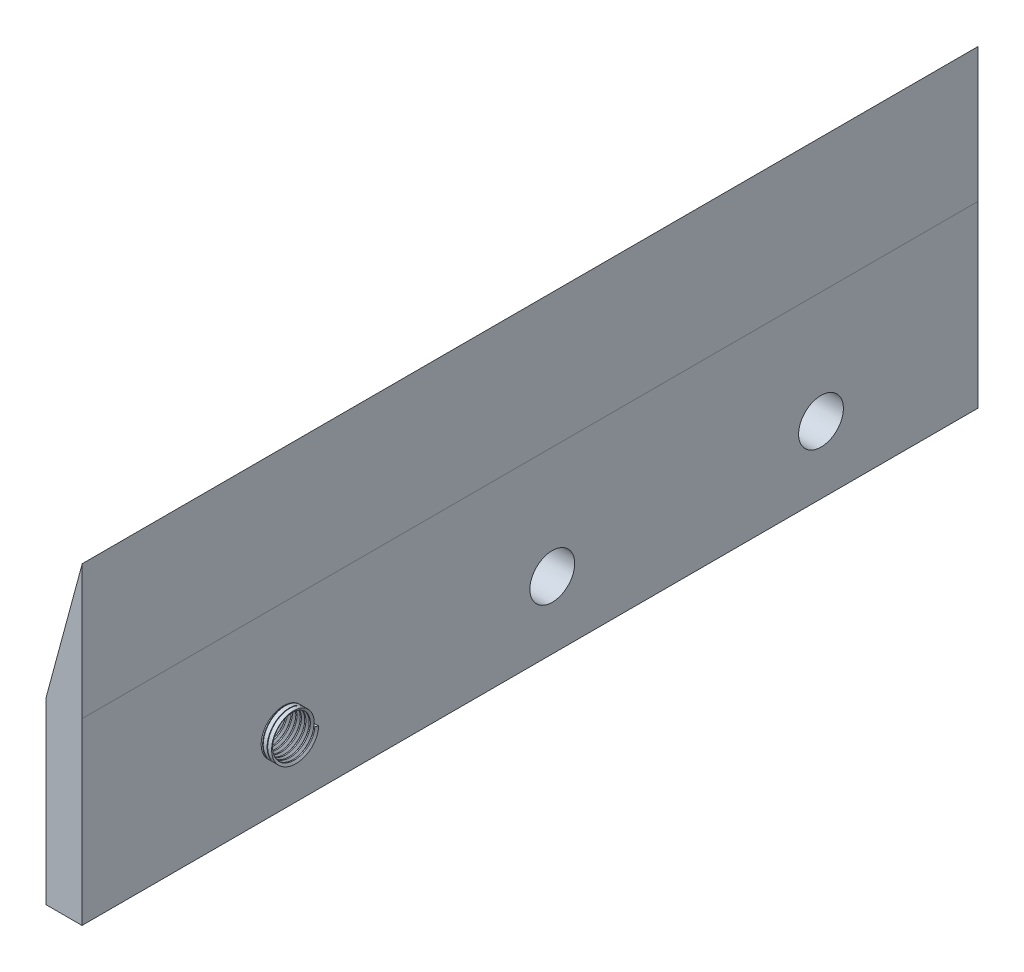
from build123d import *

# Parameters (mm, degrees)
EXTRUDE_1_DEPTH     = 200
SKETCH_2_R          = 5
CUT_EXTRUDE_1_DEPTH = 1090.704207924
THREAD_1_PITCH      = 1


with BuildPart() as part:
    # Sketch 1 → 填料-伸長1 (new body)
    with BuildSketch(Plane.XY):
        Polygon((206.662436299, 1001.176903993), (198.623972775, 1001.176903993), (198.623972775, 1041.176903993), (206.714806585, 1071.162825707), (206.662436299, 1041.162871417), align=None)
    extrude(amount=EXTRUDE_1_DEPTH)

    # 草圖2 → 除料-伸長1 (cut, through all)
    with BuildSketch(Plane(origin=(198.623972775, 0, 0), x_dir=(0, 0, -1), z_dir=(1, 0, 0))):
        with Locations(Location((-155, 1016.176903993, 0), (0, 0, 270))):
            Circle(SKETCH_2_R)
        with Locations(Location((-95, 1016.176903993, 0), (0, 0, 270))):
            Circle(SKETCH_2_R)
        with Locations(Location((-35, 1016.176903993, 0), (0, 0, 270))):
            Circle(SKETCH_2_R)
    extrude(amount=CUT_EXTRUDE_1_DEPTH, mode=Mode.SUBTRACT)

    # 螺紋1: the profile of Sketch 1 2 profile screwed along a right-hand helix of 10 turns, 8 arcs to a turn; built about Z, then put on its axis
    thread_1_z = Axis((0, 0, 0), (0, 0, 1))
    thread_1_corners = [(5.0003, 0, -0.000173206), (5.0003, 0, 0.875173202), (4.458734125, 0, 0.562499998), (4.458734125, 0, 0.312499998)]
    with BuildLine(mode=Mode.PRIVATE) as thread_1_profile:
        Line(thread_1_corners[0], thread_1_corners[1])
        Line(thread_1_corners[1], thread_1_corners[2])
        Line(thread_1_corners[2], thread_1_corners[3])
        Line(thread_1_corners[3], thread_1_corners[0])
    thread_1_cap = Face(thread_1_profile.wire())
    thread_1_turn_angles = [0, 22.5, 45, 67.5, 90, 112.5, 135, 157.5, 180, 202.5, 225, 247.5, 270, 292.5, 315, 337.5, 360]
    thread_1_turn_weights = [1, 0.9238795325112867, 1, 0.9238795325112867, 1, 0.9238795325112867, 1, 0.9238795325112867, 1, 0.9238795325112867, 1, 0.9238795325112867, 1, 0.9238795325112867, 1, 0.9238795325112867, 1]
    thread_1_turn_rails = [Edge.make_bspline([Vector(p[0], p[1], 0).rotate(thread_1_z, thread_1_turn_angles[k]) / thread_1_turn_weights[k] + Vector(0, 0, p[2] + THREAD_1_PITCH * thread_1_turn_angles[k] / 360) for k in range(17)], [0, 0, 0, 1, 1, 2, 2, 3, 3, 4, 4, 5, 5, 6, 6, 7, 7, 8, 8, 8], 2, thread_1_turn_weights) for p in thread_1_corners]
    thread_1_turn_sides = [Face.make_surface_from_curves(thread_1_turn_rails[p[0]], thread_1_turn_rails[p[1]]) for p in [(0, 1), (1, 2), (2, 3), (3, 0)]]
    thread_1 = Plane(origin=(198.623972775, 1016.176903993, 155), x_dir=(0, 0, -1), z_dir=(1, 0, 0)) * Solid(Shell([*[p.moved(Location((0, 0, THREAD_1_PITCH * i))) for i in range(10) for p in thread_1_turn_sides], thread_1_cap, thread_1_cap.rotate(thread_1_z, 3600).moved(Location((0, 0, THREAD_1_PITCH * 3600 / 360)))]))
    add(thread_1)


solid = part.part
